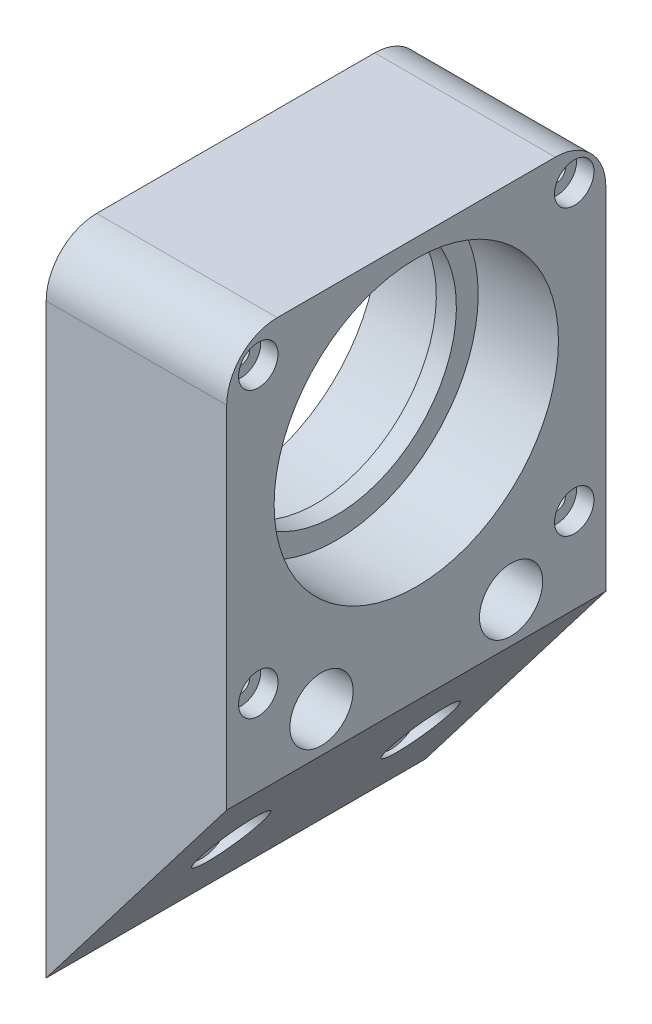
from build123d import *

# Parameters (mm, degrees)
BOSS_EXTRUDE1_DEPTH = 120
SKETCH3_R           = 4.25
CUT_EXTRUDE1_DEPTH  = 120
SKETCH5_R           = 10
CUT_EXTRUDE2_DEPTH  = 38
SKETCH6_R           = 4.25
CUT_EXTRUDE3_DEPTH  = 103
SKETCH7_W           = 57.15
SKETCH7_H           = 120
BOSS_EXTRUDE2_DEPTH = 101.6
FILLET1_R           = 16
SKETCH8_R           = 45
CUT_EXTRUDE4_DEPTH  = 25.4
CUT_EXTRUDE5_START  = -25.4
SKETCH9_R           = 45
CUT_EXTRUDE5_DEPTH  = 25.4
SKETCH10_R          = 38.1
CUT_EXTRUDE6_DEPTH  = 76.2
SKETCH11_R          = 2.75
CUT_EXTRUDE7_DEPTH  = 84.4
SKETCH12_R          = 6.25
CUT_EXTRUDE8_DEPTH  = 5.5


with BuildPart() as part:
    # Sketch1 → Boss-Extrude1 (new body)
    with BuildSketch(Plane.XY):
        Polygon((381, 457.2), (438.15, 457.2), (438.15, 431.8), (381, 357.2), align=None)
    extrude(amount=BOSS_EXTRUDE1_DEPTH)

    # Sketch3 → Cut-Extrude1 (cut)
    with BuildSketch(Plane(origin=(438.15, 0, 0), x_dir=(0, 0, -1), z_dir=(1, 0, 0))):
        with Locations((-90, 394.5)):
            Circle(SKETCH3_R)
        with Locations((-30, 394.5)):
            Circle(SKETCH3_R)
    extrude(amount=-CUT_EXTRUDE1_DEPTH, mode=Mode.SUBTRACT)

    # Sketch5 → Cut-Extrude2 (cut)
    with BuildSketch(Plane(origin=(438.15, 0, 0), x_dir=(0, 0, -1), z_dir=(1, 0, 0))):
        with Locations((-90, 394.5)):
            Circle(SKETCH5_R)
        with Locations((-30, 394.5)):
            Circle(SKETCH5_R)
        with Locations((-90, 444.5)):
            Circle(SKETCH5_R)
        with Locations((-30, 444.5)):
            Circle(SKETCH5_R)
    extrude(amount=-CUT_EXTRUDE2_DEPTH, mode=Mode.SUBTRACT)

    # Sketch6 → Cut-Extrude3 (cut)
    with BuildSketch(Plane(origin=(438.15, 0, 0), x_dir=(0, 0, -1), z_dir=(1, 0, 0))):
        with Locations((-90, 444.5)):
            Circle(SKETCH6_R)
        with Locations((-30, 444.5)):
            Circle(SKETCH6_R)
    extrude(amount=-CUT_EXTRUDE3_DEPTH, mode=Mode.SUBTRACT)

    # Sketch7 → Boss-Extrude2 (add)
    with BuildSketch(Plane(origin=(0, 457.2, 0), x_dir=(1, 0, 0), z_dir=(0, 1, 0))):
        with Locations((409.575, -60)):
            Rectangle(SKETCH7_W, SKETCH7_H)
    extrude(amount=BOSS_EXTRUDE2_DEPTH)

    # Fillet1
    fillet1_edges = [part.edges().sort_by_distance(p)[0] for p in [
        (409.575, 558.8, 0),
        (409.575, 558.8, 120),
    ]]
    fillet(fillet1_edges, radius=FILLET1_R)

    # Sketch8 → Cut-Extrude4 (cut)
    with BuildSketch(Plane.ZY.offset(-381)):
        with Locations((60, 508)):
            Circle(SKETCH8_R)
    extrude(amount=-CUT_EXTRUDE4_DEPTH, mode=Mode.SUBTRACT)

    # Sketch9 → Cut-Extrude5 (cut)
    with BuildSketch(Plane(origin=(438.15, 0, 0), x_dir=(0, 0, -1), z_dir=(1, 0, 0)).offset(CUT_EXTRUDE5_START)):
        with Locations((-60, 508)):
            Circle(SKETCH9_R)
    extrude(amount=CUT_EXTRUDE5_DEPTH, mode=Mode.SUBTRACT)

    # Sketch10 → Cut-Extrude6 (cut)
    with BuildSketch(Plane(origin=(438.15, 0, 0), x_dir=(0, 0, -1), z_dir=(1, 0, 0))):
        with Locations((-60, 508)):
            Circle(SKETCH10_R)
    extrude(amount=-CUT_EXTRUDE6_DEPTH, mode=Mode.SUBTRACT)

    # Sketch11 → Cut-Extrude7 (cut)
    with BuildSketch(Plane(origin=(438.15, 0, 0), x_dir=(0, 0, -1), z_dir=(1, 0, 0))):
        with Locations((-110, 548.8)):
            Circle(SKETCH11_R)
        with Locations((-10, 548.8)):
            Circle(SKETCH11_R)
        with Locations((-110, 458.8)):
            Circle(SKETCH11_R)
        with Locations((-10, 458.8)):
            Circle(SKETCH11_R)
    extrude(amount=-CUT_EXTRUDE7_DEPTH, mode=Mode.SUBTRACT)

    # Sketch12 → Cut-Extrude8 (cut)
    with BuildSketch(Plane(origin=(438.15, 0, 0), x_dir=(0, 0, -1), z_dir=(1, 0, 0))):
        with Locations((-110, 548.8)):
            Circle(SKETCH12_R)
        with Locations((-10, 548.8)):
            Circle(SKETCH12_R)
        with Locations((-10, 458.8)):
            Circle(SKETCH12_R)
        with Locations((-110, 458.8)):
            Circle(SKETCH12_R)
    extrude(amount=-CUT_EXTRUDE8_DEPTH, mode=Mode.SUBTRACT)


solid = part.part
